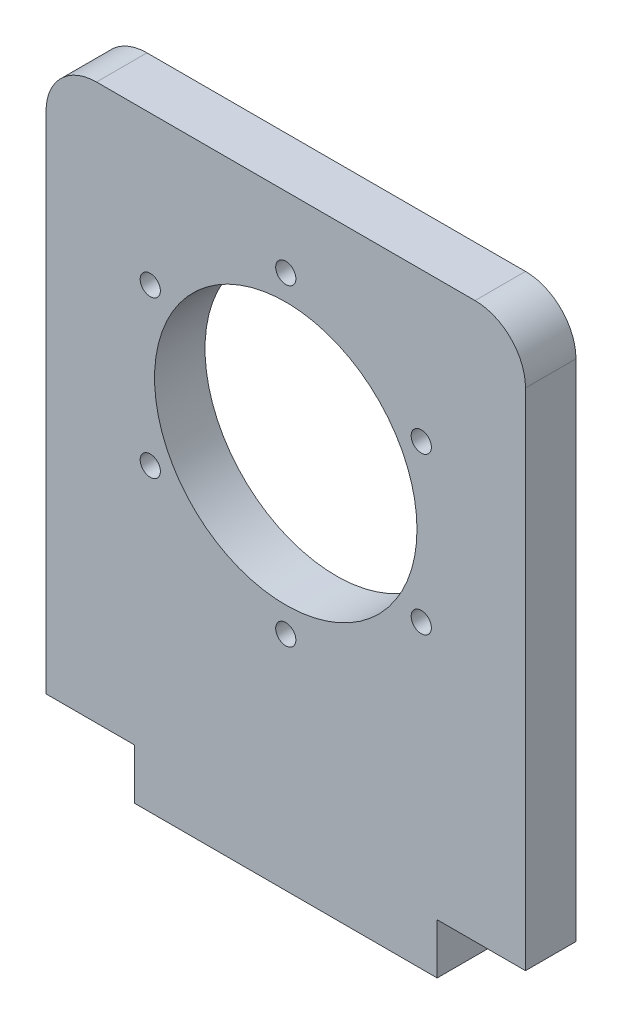
from build123d import *

# Parameters (mm, degrees)
SKETCH1_R           = 2
SKETCH1_R_2         = 26
BOSS_EXTRUDE1_DEPTH = 10
FILLET1_R           = 10


with BuildPart() as part:
    # Sketch1 → Boss-Extrude1 (new body)
    with BuildSketch(Plane.XY):
        Polygon((47.5, 45), (-47.5, 45), (-47.5, -65), (-30, -65), (-30, -75), (30, -75), (30, -65), (47.5, -65), align=None)
        with Locations((-26.846787517, -15.5)):
            Circle(SKETCH1_R, mode=Mode.SUBTRACT)
        with Locations((0, -31)):
            Circle(SKETCH1_R, mode=Mode.SUBTRACT)
        with Locations((26.846787517, -15.5)):
            Circle(SKETCH1_R, mode=Mode.SUBTRACT)
        Circle(SKETCH1_R_2, mode=Mode.SUBTRACT)
        with Locations((-26.846787517, 15.5)):
            Circle(SKETCH1_R, mode=Mode.SUBTRACT)
        with Locations((0, 31)):
            Circle(SKETCH1_R, mode=Mode.SUBTRACT)
        with Locations((26.846787517, 15.5)):
            Circle(SKETCH1_R, mode=Mode.SUBTRACT)
    extrude(amount=BOSS_EXTRUDE1_DEPTH)

    # Fillet1
    fillet1_edges = [part.edges().sort_by_distance(p)[0] for p in [
        (47.5, 45, 5),
        (-47.5, 45, 5),
    ]]
    fillet(fillet1_edges, radius=FILLET1_R)


solid = part.part
